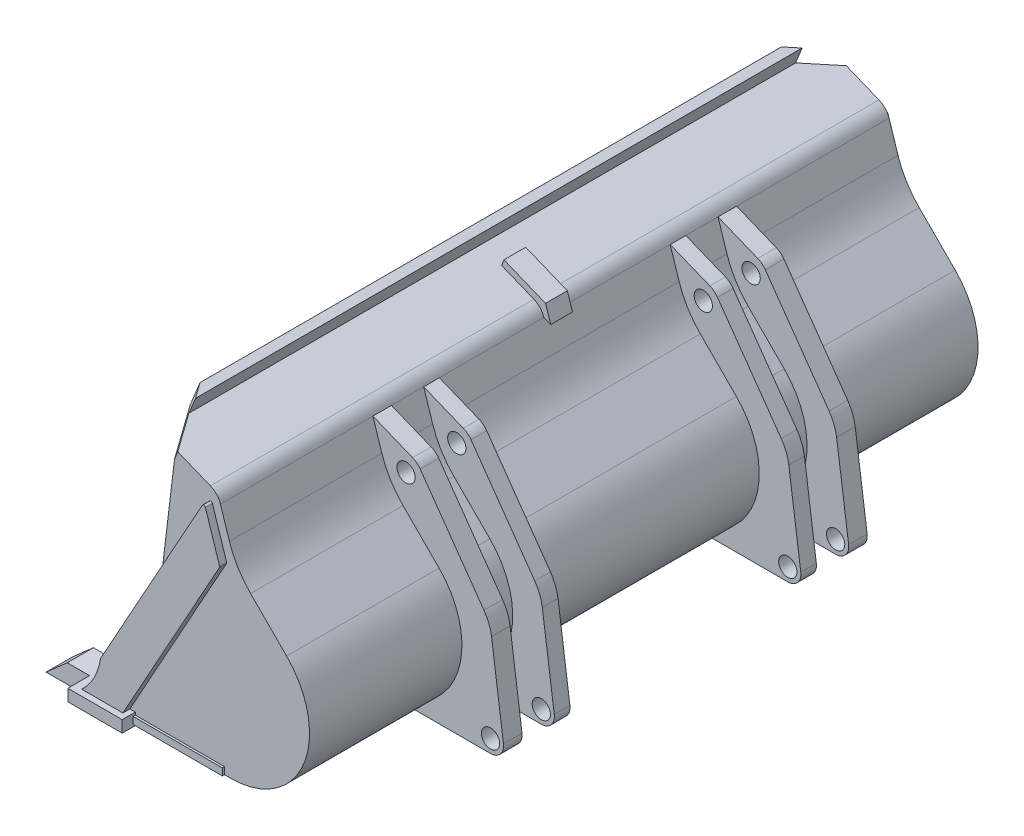
from build123d import *

# Parameters (mm, degrees)
BOSS_EXTRUDE1_DEPTH     = 38.375
FILLET1_R               = 10
FILLET2_R               = 2
FILLET3_R               = 5
SHELL1_DEPTH            = 37.375
SKETCH2_W               = 6.25
SKETCH2_H               = 1.35
BOSS_EXTRUDE2_DEPTH     = 39.875
BOSS_EXTRUDE3_START     = -1.25
SKETCH3_W               = 10.25
SKETCH3_H               = 0.8
BOSS_EXTRUDE3_DEPTH     = 38.625
BOSS_EXTRUDE4_DEPTH     = 0.8
FILLET4_R               = 0.2
CUT_EXTRUDE1_DEPTH      = 10
CUT_EXTRUDE1_DEPTH_BACK = 2
BOSS_EXTRUDE5_START     = -1.25
BOSS_EXTRUDE5_DEPTH     = 1.25
BOSS_EXTRUDE6_DEPTH     = 20.875
CUT_EXTRUDE2_START      = -2.13
CUT_EXTRUDE2_DEPTH      = 3.7
SKETCH11_W              = 40.088008229
SKETCH11_H              = 26.5
CUT_EXTRUDE5_DEPTH      = 0.25
CUT_EXTRUDE6_START      = -7.63
CUT_EXTRUDE6_DEPTH      = 26.5
CUT_EXTRUDE8_DEPTH      = 0.13
CUT_EXTRUDE9_DEPTH      = 75.796848331
CUT_EXTRUDE9_DEPTH_BACK = 75.796848331
SKETCH14_R              = 1.05
BOSS_EXTRUDE7_START     = -2.5
BOSS_EXTRUDE7_DEPTH     = 3
LPATTERN1_COUNT         = 7
LPATTERN1_PITCH         = 12


# Read off the part's stored shape, not the designer's step: Shell1
with BuildPart() as part:
    # Sketch1 → Boss-Extrude1 (new body)
    with BuildSketch(Plane.XY):
        with BuildLine():
            Line((0, 0), (0, 1))
            Line((0, 1), (7.25, 16))
            Line((7.25, 16), (8.75, 28.5))
            Line((8.75, 28.5), (5.553252135, 29.797421707))
            Line((5.553252135, 29.797421707), (6.681444923, 32.577202459))
            Line((6.681444923, 32.577202459), (7.608038507, 32.201138196))
            Line((7.608038507, 32.201138196), (6.855909982, 30.347951028))
            Line((6.855909982, 30.347951028), (13.740127414, 27.553944899))
            Line((13.740127414, 27.553944899), (15.792332521, 21.203944899))
            Line((15.792332521, 21.203944899), (21.623961423, 15.353944899))
            ThreePointArc((21.623961423, 15.353944899), (23.562205005, 5.549311959), (15.25, 0))
            Line((15.25, 0), (0, 0))
        make_face()
    extrude(amount=BOSS_EXTRUDE1_DEPTH)

    # Fillet1
    fillet1_edges = [part.edges().sort_by_distance(p)[0] for p in [
        (15.792332521, 21.203944899, 19.1875),
    ]]
    fillet(fillet1_edges, radius=FILLET1_R)

    # Fillet2
    fillet2_edges = [part.edges().sort_by_distance(p)[0] for p in [
        (13.740127414, 27.553944899, 19.1875),
    ]]
    fillet(fillet2_edges, radius=FILLET2_R)

    # Fillet3
    fillet3_edges = [part.edges().sort_by_distance(p)[0] for p in [
        (7.25, 16, 19.1875),
    ]]
    fillet(fillet3_edges, radius=FILLET3_R)

    # Shell1 outline → Shell1 (cut)
    with BuildSketch(Plane.XY):
        with BuildLine():
            ThreePointArc((13.075384834, 26.359001958), (12.856268859, 26.732328377), (12.499907783, 26.978074606))
            Line((12.499907783, 26.978074606), (8.75, 28.5))
            Line((8.75, 28.5), (7.349440549, 16.828671243))
            ThreePointArc((7.349440549, 16.828671243), (7.183607383, 16.019438965), (6.886801121, 15.248554043))
            Line((6.886801121, 15.248554043), (0, 1))
            Line((0, 1), (15.25, 1))
            ThreePointArc((15.25, 1), (22.638626671, 5.932721741), (20.915743487, 14.647951021))
            Line((20.915743487, 14.647951021), (16.779055926, 18.797670189))
            ThreePointArc((16.779055926, 18.797670189), (15.181384249, 20.830875657), (14.102498758, 23.180872543))
            Line((14.102498758, 23.180872543), (13.075384834, 26.359001958))
        make_face()
    extrude(amount=SHELL1_DEPTH, mode=Mode.SUBTRACT)

    # Sketch2 → Boss-Extrude2 (add)
    with BuildSketch(Plane.XY):
        with Locations((1.125, 0.425)):
            Rectangle(SKETCH2_W, SKETCH2_H)
    extrude(amount=BOSS_EXTRUDE2_DEPTH)

    # Sketch3 → Boss-Extrude3 (add)
    with BuildSketch(Plane.XY.offset(39.875).offset(BOSS_EXTRUDE3_START)):
        with Locations((9.375, 0.4)):
            Rectangle(SKETCH3_W, SKETCH3_H)
    extrude(amount=-BOSS_EXTRUDE3_DEPTH)

    # Sketch4 → Boss-Extrude4 (add)
    with BuildSketch(Plane.XY.offset(38.375)):
        with BuildLine():
            Line((-1.4, 0.8), (3.459254788, 0.8))
            Line((3.459254788, 0.8), (14.751696416, 21.17210397))
            Line((14.751696416, 21.17210397), (12.962021875, 26.709773325))
            Line((12.962021875, 26.709773325), (1.066675279, 5.25))
            ThreePointArc((1.066675279, 5.25), (0.233575409, 2.803144582), (-1.4, 0.8))
        make_face()
    extrude(amount=BOSS_EXTRUDE4_DEPTH)

    # Fillet4
    fillet4_edges = [part.edges().sort_by_distance(p)[0] for p in [
        (-1.070915731, 1.1, 38.775),
        (14.751696416, 21.17210397, 38.775),
        (12.962021875, 26.709773325, 38.775),
    ]]
    fillet(fillet4_edges, radius=FILLET4_R)

    # Sketch7 → Cut-Extrude1 (cut, two sides: drawn at the far end of the back side and taken through both)
    with BuildSketch(Plane(origin=(11.544601043, 28.445014101, 0), x_dir=(0.9265935841802967, -0.37606426280080313, 0), z_dir=(0.37606426280080313, 0.9265935841802967, 0)).offset(-CUT_EXTRUDE1_DEPTH_BACK)):
        Polygon((-5.060137628, -38.375), (-2.610137628, -38.375), (-5.060137628, -34.824275362), align=None)
        Polygon((-5.060137628, -38.375), (-5.060137628, -34.824275362), (-6.060137628, -33.375), (-6.060137628, -38.375), align=None)
    extrude(amount=CUT_EXTRUDE1_DEPTH + CUT_EXTRUDE1_DEPTH_BACK, mode=Mode.SUBTRACT)

    # Sketch8 → Boss-Extrude5 (add)
    with BuildSketch(Plane(origin=(0, 0, 0), x_dir=(-1, 0, 0), z_dir=(0, 0, -1)).offset(BOSS_EXTRUDE5_START)):
        with BuildLine():
            Line((-9.169597709, 29.408925241), (-9.451645906, 30.103870429))
            Line((-9.451645906, 30.103870429), (-14.225275672, 28.166460555))
            Line((-14.225275672, 28.166460555), (-15.567990813, 24.011787559))
            Line((-15.567990813, 24.011787559), (-14.949488958, 23.81189895))
            Line((-14.949488958, 23.81189895), (-14.026926149, 26.666522894))
            ThreePointArc((-14.026926149, 26.666522894), (-13.588694199, 27.413175733), (-12.875972045, 27.90466819))
            Line((-12.875972045, 27.90466819), (-9.169597709, 29.408925241))
        make_face()
    extrude(amount=BOSS_EXTRUDE5_DEPTH)

    # Mirror1: part across plane


with BuildPart() as part_1:
    add(part.part)
    add(part.part.mirror(Plane.XY))

    # Sketch10 → Boss-Extrude6 (add, symmetric)
    with BuildSketch(Plane.XY):
        with BuildLine():
            Line((4.25, 0), (4.25, -0.13))
            Line((4.25, -0.13), (27.529844991, -0.13))
            ThreePointArc((27.529844991, -0.13), (28.660381123, 0.384156172), (29.015887749, 1.574149263))
            Line((29.015887749, 1.574149263), (27.646431216, 11.542693534))
            ThreePointArc((27.646431216, 11.542693534), (27.34474629, 12.695455685), (26.778863015, 13.744097898))
            Line((26.778863015, 13.744097898), (19.461521859, 24.118489968))
            ThreePointArc((19.461521859, 24.118489968), (19.070736221, 24.532099272), (18.57928732, 24.818916374))
            Line((18.57928732, 24.818916374), (14.026926149, 26.666522894))
            Line((14.026926149, 26.666522894), (15.054040073, 23.488393479))
            ThreePointArc((15.054040073, 23.488393479), (16.034845065, 21.352032674), (17.487273862, 19.503664067))
            Line((17.487273862, 19.503664067), (21.623961423, 15.353944899))
            ThreePointArc((21.623961423, 15.353944899), (23.562205005, 5.549311959), (15.25, 0))
            Line((15.25, 0), (14.5, 0))
            Line((14.5, 0), (4.25, 0))
        make_face()
    extrude(amount=BOSS_EXTRUDE6_DEPTH, both=True)

    # Sketch12 → Cut-Extrude2 (cut)
    with BuildSketch(Plane.XY.offset(20.875).offset(CUT_EXTRUDE2_START)):
        with BuildLine():
            Line((15.25, 0), (15.25, -0.13))
            Line((15.25, -0.13), (27.529844991, -0.13))
            ThreePointArc((27.529844991, -0.13), (28.660381123, 0.384156172), (29.015887749, 1.574149263))
            Line((29.015887749, 1.574149263), (27.646431216, 11.542693534))
            ThreePointArc((27.646431216, 11.542693534), (27.34474629, 12.695455685), (26.778863015, 13.744097898))
            Line((26.778863015, 13.744097898), (19.461521859, 24.118489968))
            ThreePointArc((19.461521859, 24.118489968), (19.070736221, 24.532099272), (18.57928732, 24.818916374))
            Line((18.57928732, 24.818916374), (14.026926149, 26.666522894))
            Line((14.026926149, 26.666522894), (15.054040073, 23.488393479))
            ThreePointArc((15.054040073, 23.488393479), (16.034845065, 21.352032674), (17.487273862, 19.503664067))
            Line((17.487273862, 19.503664067), (21.623961423, 15.353944899))
            ThreePointArc((21.623961423, 15.353944899), (23.562205005, 5.549311959), (15.25, 0))
        make_face()
    cut_extrude2 = extrude(amount=-CUT_EXTRUDE2_DEPTH, mode=Mode.SUBTRACT)

    # Sketch11 → Cut-Extrude5 (cut)
    with BuildSketch(Plane(origin=(0, 0, 0), x_dir=(1, 0, 0), z_dir=(0, 1, 0))):
        with Locations((20.044004115, 0)):
            Rectangle(SKETCH11_W, SKETCH11_H)
    extrude(amount=-CUT_EXTRUDE5_DEPTH, mode=Mode.SUBTRACT)

    # Sketch12<2> → Cut-Extrude6 (cut)
    with BuildSketch(Plane.XY.offset(20.875).offset(CUT_EXTRUDE6_START)):
        with BuildLine():
            Line((15.25, 0), (15.25, -0.13))
            Line((15.25, -0.13), (27.529844991, -0.13))
            ThreePointArc((27.529844991, -0.13), (28.660381123, 0.384156172), (29.015887749, 1.574149263))
            Line((29.015887749, 1.574149263), (27.646431216, 11.542693534))
            ThreePointArc((27.646431216, 11.542693534), (27.34474629, 12.695455685), (26.778863015, 13.744097898))
            Line((26.778863015, 13.744097898), (19.461521859, 24.118489968))
            ThreePointArc((19.461521859, 24.118489968), (19.070736221, 24.532099272), (18.57928732, 24.818916374))
            Line((18.57928732, 24.818916374), (14.026926149, 26.666522894))
            Line((14.026926149, 26.666522894), (15.054040073, 23.488393479))
            ThreePointArc((15.054040073, 23.488393479), (16.034845065, 21.352032674), (17.487273862, 19.503664067))
            Line((17.487273862, 19.503664067), (21.623961423, 15.353944899))
            ThreePointArc((21.623961423, 15.353944899), (23.562205005, 5.549311959), (15.25, 0))
        make_face()
    extrude(amount=-CUT_EXTRUDE6_DEPTH, mode=Mode.SUBTRACT)

    # Sketch13 → Cut-Extrude8 (cut)
    with BuildSketch(Plane.XZ.offset(0.13)):
        with BuildLine():
            Line((15.25, 18.745), (15.25, 15.045))
            ThreePointArc((15.25, 15.045), (13.4, 16.895), (15.25, 18.745))
        make_face()
    cut_extrude8 = extrude(amount=-CUT_EXTRUDE8_DEPTH, mode=Mode.SUBTRACT)

    # Mirror2: Cut-Extrude2, Cut-Extrude8 across plane
    add(cut_extrude2.mirror(Plane.XY), mode=Mode.SUBTRACT)
    add(cut_extrude8.mirror(Plane.XY), mode=Mode.SUBTRACT)

    # Sketch14 → Cut-Extrude9 (cut, two sides: drawn at the far end of the back side and taken through both)
    with BuildSketch(Plane.XY.offset(20.875).offset(-CUT_EXTRUDE9_DEPTH_BACK)):
        with Locations((27.529844991, 1.37)):
            Circle(SKETCH14_R)
        with Locations((17.827158795, 22.965729206)):
            Circle(SKETCH14_R)
    extrude(amount=CUT_EXTRUDE9_DEPTH + CUT_EXTRUDE9_DEPTH_BACK, mode=Mode.SUBTRACT)

    # Sketch15 → Boss-Extrude7 (add)
    with BuildSketch(Plane.XY.offset(39.875).offset(BOSS_EXTRUDE7_START)):
        Polygon((4.25, 1.1), (3.75, -0.25), (3.75, -1.05), (-7, -1.05), (-4.562788479, 1.1), align=None)
    boss_extrude7 = extrude(amount=-BOSS_EXTRUDE7_DEPTH)

    # LPattern1: Boss-Extrude7 ×7
    with Locations(*[(0, 0, -i * LPATTERN1_PITCH) for i in range(1, LPATTERN1_COUNT)]):
        add(boss_extrude7)


solid = part_1.part
